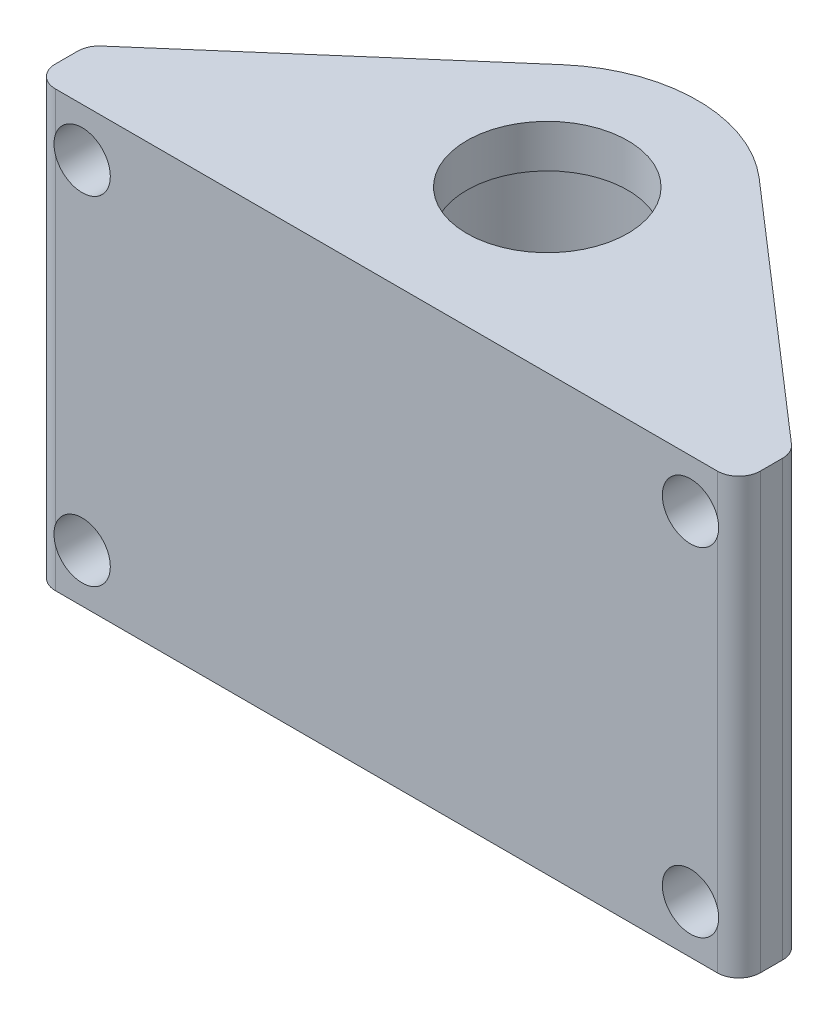
from build123d import *

# Parameters (mm, degrees)
CROQUIS2_R              = 12.7
CROQUIS2_R_2            = 9.525
SALIENTE_EXTRUIR1_DEPTH = 51.435
CORTAR_EXTRUIR1_START   = -5.08
CROQUIS3_R              = 12.7
CORTAR_EXTRUIR1_DEPTH   = 71.699448436
CROQUIS4_R              = 3.33375
SALIENTE_EXTRUIR3_DEPTH = 6.35
CROQUIS4_2_R            = 3.33375
CORTAR_EXTRUIR3_DEPTH   = 76.779448436
REDONDEO3_R             = 2.54


with BuildPart() as part:
    # Croquis2 → Saliente-Extruir1 (new body)
    # profile 1 of 2: a face of its own
    with BuildSketch(Plane(origin=(0, 0, 0), x_dir=(1, 0, 0), z_dir=(0, 1, 0))):
        with BuildLine():
            Line((41.7195, 6.35), (11.662827783, 32.470389268))
            ThreePointArc((11.662827783, 32.470389268), (6.225507161, 35.70447269), (0, 36.83))
            ThreePointArc((0, 36.83), (-6.225507161, 35.70447269), (-11.662827783, 32.470389268))
            Line((-11.662827783, 32.470389268), (-41.7195, 6.35))
            Line((-41.7195, 6.35), (-41.7195, 0))
            Line((-41.7195, 0), (41.7195, 0))
            Line((41.7195, 0), (41.7195, 6.35))
        make_face()
        with Locations((0, 19.05)):
            Circle(CROQUIS2_R, mode=Mode.SUBTRACT)
    # profile 2 of 2: a face of its own
    with BuildSketch(Plane(origin=(0, 0, 0), x_dir=(1, 0, 0), z_dir=(0, 1, 0))):
        with Locations((0, 19.05)):
            Circle(CROQUIS2_R)
        with Locations(Location((0, 19.05, 0), (0, 0, 270))):
            Circle(CROQUIS2_R_2, mode=Mode.SUBTRACT)
    extrude(amount=-SALIENTE_EXTRUIR1_DEPTH)

    # Croquis3 → Cortar-Extruir1 (cut, through all)
    with BuildSketch(Plane(origin=(0, 0, 0), x_dir=(1, 0, 0), z_dir=(0, 1, 0)).offset(CORTAR_EXTRUIR1_START)):
        with Locations(Location((0, 19.05, 0), (0, 0, 270))):
            Circle(CROQUIS3_R)
    extrude(amount=-CORTAR_EXTRUIR1_DEPTH, mode=Mode.SUBTRACT)

    # Croquis4 → Saliente-Extruir3 (add)
    with BuildSketch(Plane.XY):
        with Locations((-36.000000009, -5.717499995)):
            Circle(CROQUIS4_R)
        with Locations((36.000000009, -5.717499995)):
            Circle(CROQUIS4_R)
        with Locations((36.000000009, -45.717500005)):
            Circle(CROQUIS4_R)
        with Locations((-36.000000009, -45.717500005)):
            Circle(CROQUIS4_R)
    extrude(amount=-SALIENTE_EXTRUIR3_DEPTH)

    # Croquis4<2> → Cortar-Extruir3 (cut, through all)
    with BuildSketch(Plane.XY):
        with Locations((-36.000000009, -5.717499995)):
            Circle(CROQUIS4_2_R)
        with Locations((36.000000009, -5.717499995)):
            Circle(CROQUIS4_2_R)
        with Locations((36.000000009, -45.717500005)):
            Circle(CROQUIS4_2_R)
        with Locations((-36.000000009, -45.717500005)):
            Circle(CROQUIS4_2_R)
    extrude(amount=-CORTAR_EXTRUIR3_DEPTH, mode=Mode.SUBTRACT)

    # Redondeo3
    # the kernel refuses this fillet: 2.54 mm, written as the material it takes off along each edge
    with BuildSketch(Plane(origin=(41.7195, 2.894405132, -6.35), x_dir=(-0.7548025459958689, 0, -0.6559520687963062), z_dir=(0, -1, 0))) as redondeo3_piece_1:
        with BuildLine():
            CenterArc((REDONDEO3_R * 0.455811831887, -REDONDEO3_R), REDONDEO3_R, 90, 49.008119667)
            Line((-REDONDEO3_R * 0.298990714108, -REDONDEO3_R * 0.344047931204), (0, 0))
            Line((0, 0), (REDONDEO3_R * 0.455811831887, 0))
        make_face()
    extrude(amount=57.223810265, mode=Mode.SUBTRACT)
    with BuildSketch(Plane(origin=(41.7195, 6.35, 0), x_dir=(0, 0, -1), z_dir=(0, -1, 0)), Plane(origin=(-41.7195, 6.35, 0), x_dir=(1, 0, 0), z_dir=(0, -1, 0))) as redondeo3_piece_2:
        with BuildLine():
            CenterArc((REDONDEO3_R, -REDONDEO3_R), REDONDEO3_R, 90, 90)
            Line((0, -REDONDEO3_R), (0, 0))
            Line((0, 0), (REDONDEO3_R, 0))
        make_face()
    extrude(amount=64.135, mode=Mode.SUBTRACT)
    with BuildSketch(Plane(origin=(-41.7195, 2.894405132, -6.35), x_dir=(0.7548025459958687, 0, -0.6559520687963067), z_dir=(0, -1, 0))) as redondeo3_piece_3:
        with BuildLine():
            CenterArc((REDONDEO3_R * 0.455811831887, REDONDEO3_R), REDONDEO3_R, 220.991880333, 49.008119667)
            Line((-REDONDEO3_R * 0.298990714108, REDONDEO3_R * 0.344047931204), (0, 0))
            Line((0, 0), (REDONDEO3_R * 0.455811831887, 0))
        make_face()
    extrude(amount=57.223810265, mode=Mode.SUBTRACT)


solid = part.part
